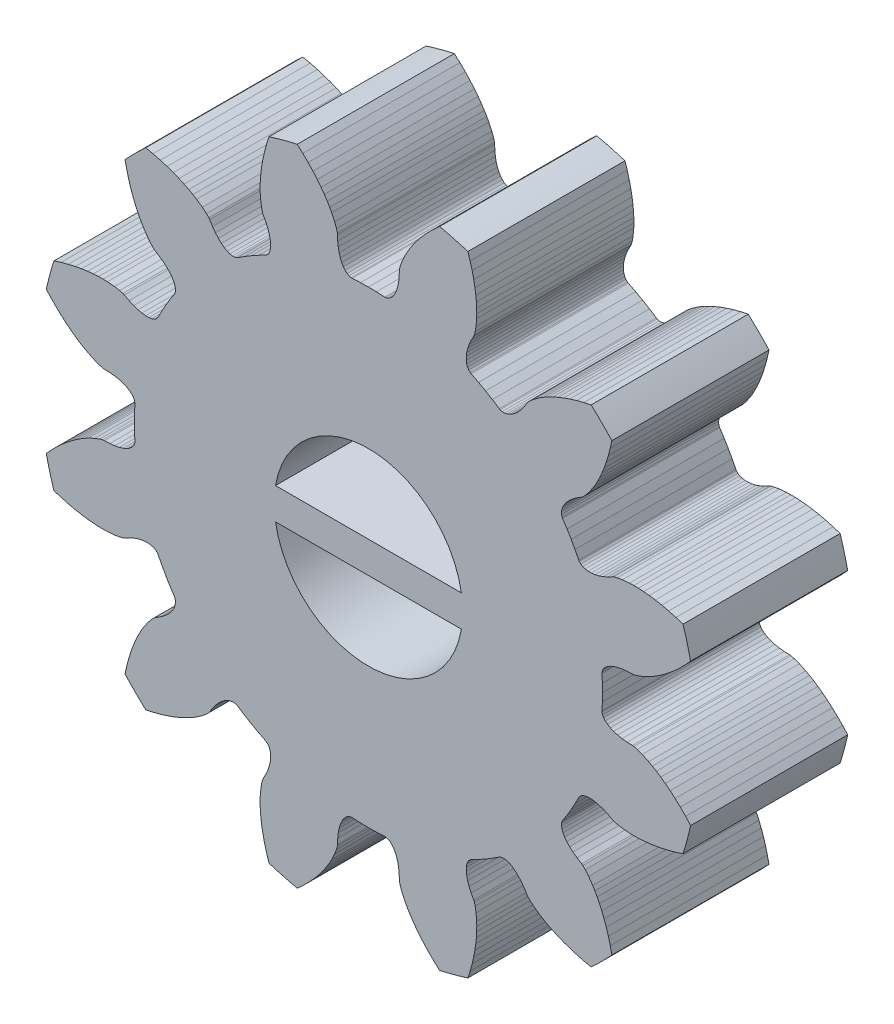
from build123d import *

# Parameters (mm, degrees)
DODANIE_WYCI_GNI_CIE1_DEPTH = 5


with BuildPart() as part:
    # szkic → Dodanie-wyciągnięcie1 (new body)
    with BuildSketch(Plane.XY):
        with BuildLine():
            Line((13.3041035, -6.8561363), (13.3646303, -6.6242917))
            Line((13.3646303, -6.6242917), (13.4304655, -6.4093816))
            Line((13.4304655, -6.4093816), (13.5002922, -6.2114851))
            Line((13.5002922, -6.2114851), (13.5727071, -6.0307313))
            Line((13.5727071, -6.0307313), (13.646359, -5.8670802))
            Line((13.646359, -5.8670802), (13.721124, -5.718017))
            Line((13.721124, -5.718017), (13.7934881, -5.5876952))
            Line((13.7934881, -5.5876952), (13.8641894, -5.4719934))
            Line((13.8641894, -5.4719934), (13.993399, -5.287051))
            Line((13.993399, -5.287051), (14.1005731, -5.157982))
            Line((14.1005731, -5.157982), (14.1765304, -5.080584))
            Line((14.1765304, -5.080584), (14.2152558, -5.0521983))
            Line((14.2152558, -5.0521983), (14.3621288, -4.9615699))
            Line((14.3621288, -4.9615699), (14.4896324, -4.8681526))
            Line((14.4896324, -4.8681526), (14.5978226, -4.7734035))
            Line((14.5978226, -4.7734035), (14.6868312, -4.6787708))
            Line((14.6868312, -4.6787708), (14.7568878, -4.5856924))
            Line((14.7568878, -4.5856924), (14.8083, -4.495561))
            Line((14.8083, -4.495561), (14.8414711, -4.409795))
            Line((14.8414711, -4.409795), (14.8568795, -4.3297232))
            Line((14.8568795, -4.3297232), (14.8550807, -4.2566876))
            Line((14.8550807, -4.2566876), (14.8367255, -4.1919755))
            Line((14.8367255, -4.1919755), (14.821549, -4.163129))
            Line((14.821549, -4.163129), (14.6787997, -3.9427598))
            Line((14.6787997, -3.9427598), (14.5481107, -3.725))
            Line((14.5481107, -3.725), (14.4248697, -3.5029402))
            Line((14.4248697, -3.5029402), (14.305399, -3.269131))
            Line((14.305399, -3.269131), (14.2880055, -3.2415645))
            Line((14.2880055, -3.2415645), (14.2411407, -3.1933124))
            Line((14.2411407, -3.1933124), (14.1787895, -3.1552368))
            Line((14.1787895, -3.1552368), (14.1017411, -3.128545))
            Line((14.1017411, -3.128545), (14.01088, -3.114389))
            Line((14.01088, -3.114389), (13.9071178, -3.1138476))
            Line((13.9071178, -3.1138476), (13.7914812, -3.1279792))
            Line((13.7914812, -3.1279792), (13.6650226, -3.1577465))
            Line((13.6650226, -3.1577465), (13.5288724, -3.2040674))
            Line((13.5288724, -3.2040674), (13.3842188, -3.2677801))
            Line((13.3842188, -3.2677801), (13.2322958, -3.3496617))
            Line((13.2322958, -3.3496617), (13.1883504, -3.369006))
            Line((13.1883504, -3.369006), (13.0833431, -3.396088))
            Line((13.0833431, -3.396088), (12.917979, -3.424369))
            Line((12.917979, -3.424369), (12.6932094, -3.4437966))
            Line((12.6932094, -3.4437966), (12.5576581, -3.4471748))
            Line((12.5576581, -3.4471748), (12.408614, -3.444683))
            Line((12.408614, -3.444683), (12.242139, -3.4348998))
            Line((12.242139, -3.4348998), (12.0635871, -3.4168587))
            Line((12.0635871, -3.4168587), (11.8708422, -3.3891949))
            Line((11.8708422, -3.3891949), (11.6645455, -3.3507184))
            Line((11.6645455, -3.3507184), (11.4455103, -3.3002783))
            Line((11.4455103, -3.3002783), (11.2144635, -3.2367737))
            Line((11.2144635, -3.2367737), (10.9882086, -3.1643386))
            ThreePointArc((10.9882086, -3.1643386), (10.857824593, -2.717587715), (10.747365, -2.2654981))
            Line((10.747365, -2.2654981), (10.90709, -2.08964))
            Line((10.90709, -2.08964), (11.07543, -1.91912))
            Line((11.07543, -1.91912), (11.2399, -1.76592))
            Line((11.2399, -1.76592), (11.39932, -1.62945))
            Line((11.39932, -1.62945), (11.55241, -1.50912))
            Line((11.55241, -1.50912), (11.69802, -1.40422))
            Line((11.69802, -1.40422), (11.8373, -1.31251))
            Line((11.8373, -1.31251), (11.96513, -1.23583))
            Line((11.96513, -1.23583), (12.08421, -1.17098))
            Line((12.08421, -1.17098), (12.28858, -1.07542))
            Line((12.28858, -1.07542), (12.44593, -1.01723))
            Line((12.44593, -1.01723), (12.55041, -0.98818))
            Line((12.55041, -0.98818), (12.59814, -0.98296))
            Line((12.59814, -0.98296), (12.77065, -0.97791))
            Line((12.77065, -0.97791), (12.92778, -0.96076))
            Line((12.92778, -0.96076), (13.06885, -0.9328))
            Line((13.06885, -0.9328), (13.19325, -0.89535))
            Line((13.19325, -0.89535), (13.30046, -0.84977))
            Line((13.30046, -0.84977), (13.39005, -0.79742))
            Line((13.39005, -0.79742), (13.46166, -0.73973))
            Line((13.46166, -0.73973), (13.51504, -0.67809))
            Line((13.51504, -0.67809), (13.55, -0.61394))
            Line((13.55, -0.61394), (13.56646, -0.54872))
            Line((13.56646, -0.54872), (13.56774, -0.51615))
            Line((13.56774, -0.51615), (13.5543, -0.25393))
            Line((13.5543, -0.25393), (13.55, 0))
            Line((13.55, 0), (13.5543, 0.25393))
            Line((13.5543, 0.25393), (13.56774, 0.51615))
            Line((13.56774, 0.51615), (13.56646, 0.54872))
            Line((13.56646, 0.54872), (13.55, 0.61394))
            Line((13.55, 0.61394), (13.51504, 0.67809))
            Line((13.51504, 0.67809), (13.46166, 0.73973))
            Line((13.46166, 0.73973), (13.39005, 0.79742))
            Line((13.39005, 0.79742), (13.30046, 0.84977))
            Line((13.30046, 0.84977), (13.19325, 0.89535))
            Line((13.19325, 0.89535), (13.06885, 0.9328))
            Line((13.06885, 0.9328), (12.92778, 0.96076))
            Line((12.92778, 0.96076), (12.77065, 0.97791))
            Line((12.77065, 0.97791), (12.59814, 0.98296))
            Line((12.59814, 0.98296), (12.55041, 0.98818))
            Line((12.55041, 0.98818), (12.44593, 1.01723))
            Line((12.44593, 1.01723), (12.28858, 1.07542))
            Line((12.28858, 1.07542), (12.08421, 1.17098))
            Line((12.08421, 1.17098), (11.96513, 1.23583))
            Line((11.96513, 1.23583), (11.8373, 1.31251))
            Line((11.8373, 1.31251), (11.69802, 1.40422))
            Line((11.69802, 1.40422), (11.55241, 1.50912))
            Line((11.55241, 1.50912), (11.39932, 1.62945))
            Line((11.39932, 1.62945), (11.2399, 1.76592))
            Line((11.2399, 1.76592), (11.07543, 1.91912))
            Line((11.07543, 1.91912), (10.90709, 2.08964))
            Line((10.90709, 2.08964), (10.747365, 2.2654981))
            ThreePointArc((10.747365, 2.2654981), (10.857824593, 2.717587715), (10.9882086, 3.1643386))
            Line((10.9882086, 3.1643386), (11.2144635, 3.2367737))
            Line((11.2144635, 3.2367737), (11.4455103, 3.3002783))
            Line((11.4455103, 3.3002783), (11.6645455, 3.3507184))
            Line((11.6645455, 3.3507184), (11.8708422, 3.3891949))
            Line((11.8708422, 3.3891949), (12.0635871, 3.4168587))
            Line((12.0635871, 3.4168587), (12.242139, 3.4348998))
            Line((12.242139, 3.4348998), (12.408614, 3.444683))
            Line((12.408614, 3.444683), (12.5576581, 3.4471748))
            Line((12.5576581, 3.4471748), (12.6932094, 3.4437966))
            Line((12.6932094, 3.4437966), (12.917979, 3.424369))
            Line((12.917979, 3.424369), (13.0833431, 3.396088))
            Line((13.0833431, 3.396088), (13.1883504, 3.369006))
            Line((13.1883504, 3.369006), (13.2322958, 3.3496617))
            Line((13.2322958, 3.3496617), (13.3842188, 3.2677801))
            Line((13.3842188, 3.2677801), (13.5288724, 3.2040674))
            Line((13.5288724, 3.2040674), (13.6650226, 3.1577465))
            Line((13.6650226, 3.1577465), (13.7914812, 3.1279792))
            Line((13.7914812, 3.1279792), (13.9071178, 3.1138476))
            Line((13.9071178, 3.1138476), (14.01088, 3.114389))
            Line((14.01088, 3.114389), (14.1017411, 3.128545))
            Line((14.1017411, 3.128545), (14.1787895, 3.1552368))
            Line((14.1787895, 3.1552368), (14.2411407, 3.1933124))
            Line((14.2411407, 3.1933124), (14.2880055, 3.2415645))
            Line((14.2880055, 3.2415645), (14.305399, 3.269131))
            Line((14.305399, 3.269131), (14.4248697, 3.5029402))
            Line((14.4248697, 3.5029402), (14.5481107, 3.725))
            Line((14.5481107, 3.725), (14.6787997, 3.9427598))
            Line((14.6787997, 3.9427598), (14.821549, 4.163129))
            Line((14.821549, 4.163129), (14.8367255, 4.1919755))
            Line((14.8367255, 4.1919755), (14.8550807, 4.2566876))
            Line((14.8550807, 4.2566876), (14.8568795, 4.3297232))
            Line((14.8568795, 4.3297232), (14.8414711, 4.409795))
            Line((14.8414711, 4.409795), (14.8083, 4.495561))
            Line((14.8083, 4.495561), (14.7568878, 4.5856924))
            Line((14.7568878, 4.5856924), (14.6868312, 4.6787708))
            Line((14.6868312, 4.6787708), (14.5978226, 4.7734035))
            Line((14.5978226, 4.7734035), (14.4896324, 4.8681526))
            Line((14.4896324, 4.8681526), (14.3621288, 4.9615699))
            Line((14.3621288, 4.9615699), (14.2152558, 5.0521983))
            Line((14.2152558, 5.0521983), (14.1765304, 5.080584))
            Line((14.1765304, 5.080584), (14.1005731, 5.157982))
            Line((14.1005731, 5.157982), (13.993399, 5.287051))
            Line((13.993399, 5.287051), (13.8641894, 5.4719934))
            Line((13.8641894, 5.4719934), (13.7934881, 5.5876952))
            Line((13.7934881, 5.5876952), (13.721124, 5.718017))
            Line((13.721124, 5.718017), (13.646359, 5.8670802))
            Line((13.646359, 5.8670802), (13.5727071, 6.0307313))
            Line((13.5727071, 6.0307313), (13.5002922, 6.2114851))
            Line((13.5002922, 6.2114851), (13.4304655, 6.4093816))
            Line((13.4304655, 6.4093816), (13.3646303, 6.6242917))
            Line((13.3646303, 6.6242917), (13.3041035, 6.8561363))
            Line((13.3041035, 6.8561363), (13.2537067, 7.0882964))
            ThreePointArc((13.2537067, 7.0882964), (13.575412309, 7.424587691), (13.9117036, 7.7462933))
            Line((13.9117036, 7.7462933), (14.1438637, 7.6958965))
            Line((14.1438637, 7.6958965), (14.3757083, 7.6353697))
            Line((14.3757083, 7.6353697), (14.5906184, 7.5695345))
            Line((14.5906184, 7.5695345), (14.7885149, 7.4997078))
            Line((14.7885149, 7.4997078), (14.9692687, 7.4272929))
            Line((14.9692687, 7.4272929), (15.1329198, 7.353641))
            Line((15.1329198, 7.353641), (15.281983, 7.278876))
            Line((15.281983, 7.278876), (15.4123048, 7.2065119))
            Line((15.4123048, 7.2065119), (15.5280066, 7.1358106))
            Line((15.5280066, 7.1358106), (15.712949, 7.006601))
            Line((15.712949, 7.006601), (15.842018, 6.8994269))
            Line((15.842018, 6.8994269), (15.919416, 6.8234696))
            Line((15.919416, 6.8234696), (15.9478017, 6.7847442))
            Line((15.9478017, 6.7847442), (16.0384301, 6.6378712))
            Line((16.0384301, 6.6378712), (16.1318474, 6.5103676))
            Line((16.1318474, 6.5103676), (16.2265965, 6.4021774))
            Line((16.2265965, 6.4021774), (16.3212292, 6.3131688))
            Line((16.3212292, 6.3131688), (16.4143076, 6.2431122))
            Line((16.4143076, 6.2431122), (16.504439, 6.1917))
            Line((16.504439, 6.1917), (16.590205, 6.1585289))
            Line((16.590205, 6.1585289), (16.6702768, 6.1431205))
            Line((16.6702768, 6.1431205), (16.7433124, 6.1449193))
            Line((16.7433124, 6.1449193), (16.8080245, 6.1632745))
            Line((16.8080245, 6.1632745), (16.836871, 6.178451))
            Line((16.836871, 6.178451), (17.0572402, 6.3212003))
            Line((17.0572402, 6.3212003), (17.275, 6.4518893))
            Line((17.275, 6.4518893), (17.4970598, 6.5751303))
            Line((17.4970598, 6.5751303), (17.730869, 6.694601))
            Line((17.730869, 6.694601), (17.7584355, 6.7119945))
            Line((17.7584355, 6.7119945), (17.8066876, 6.7588593))
            Line((17.8066876, 6.7588593), (17.8447632, 6.8212105))
            Line((17.8447632, 6.8212105), (17.871455, 6.8982589))
            Line((17.871455, 6.8982589), (17.885611, 6.98912))
            Line((17.885611, 6.98912), (17.8861524, 7.0928822))
            Line((17.8861524, 7.0928822), (17.8720208, 7.2085188))
            Line((17.8720208, 7.2085188), (17.8422535, 7.3349774))
            Line((17.8422535, 7.3349774), (17.7959326, 7.4711276))
            Line((17.7959326, 7.4711276), (17.7322199, 7.6157812))
            Line((17.7322199, 7.6157812), (17.6503383, 7.7677042))
            Line((17.6503383, 7.7677042), (17.630994, 7.8116496))
            Line((17.630994, 7.8116496), (17.603912, 7.9166569))
            Line((17.603912, 7.9166569), (17.575631, 8.082021))
            Line((17.575631, 8.082021), (17.5562034, 8.3067906))
            Line((17.5562034, 8.3067906), (17.5528252, 8.4423419))
            Line((17.5528252, 8.4423419), (17.555317, 8.591386))
            Line((17.555317, 8.591386), (17.5651002, 8.757861))
            Line((17.5651002, 8.757861), (17.5831413, 8.9364129))
            Line((17.5831413, 8.9364129), (17.6108051, 9.1291578))
            Line((17.6108051, 9.1291578), (17.6492816, 9.3354545))
            Line((17.6492816, 9.3354545), (17.6997217, 9.5544897))
            Line((17.6997217, 9.5544897), (17.7632263, 9.7855365))
            Line((17.7632263, 9.7855365), (17.8356614, 10.0117914))
            ThreePointArc((17.8356614, 10.0117914), (18.282412285, 10.142175407), (18.7345019, 10.252635))
            Line((18.7345019, 10.252635), (18.91036, 10.09291))
            Line((18.91036, 10.09291), (19.08088, 9.92457))
            Line((19.08088, 9.92457), (19.23408, 9.7601))
            Line((19.23408, 9.7601), (19.37055, 9.60068))
            Line((19.37055, 9.60068), (19.49088, 9.44759))
            Line((19.49088, 9.44759), (19.59578, 9.30198))
            Line((19.59578, 9.30198), (19.68749, 9.1627))
            Line((19.68749, 9.1627), (19.76417, 9.03487))
            Line((19.76417, 9.03487), (19.82902, 8.91579))
            Line((19.82902, 8.91579), (19.92458, 8.71142))
            Line((19.92458, 8.71142), (19.98277, 8.55407))
            Line((19.98277, 8.55407), (20.01182, 8.44959))
            Line((20.01182, 8.44959), (20.01704, 8.40186))
            Line((20.01704, 8.40186), (20.02209, 8.22935))
            Line((20.02209, 8.22935), (20.03924, 8.07222))
            Line((20.03924, 8.07222), (20.0672, 7.93115))
            Line((20.0672, 7.93115), (20.10465, 7.80675))
            Line((20.10465, 7.80675), (20.15023, 7.69954))
            Line((20.15023, 7.69954), (20.20258, 7.60995))
            Line((20.20258, 7.60995), (20.26027, 7.53834))
            Line((20.26027, 7.53834), (20.32191, 7.48496))
            Line((20.32191, 7.48496), (20.38606, 7.45))
            Line((20.38606, 7.45), (20.45128, 7.43354))
            Line((20.45128, 7.43354), (20.48385, 7.43226))
            Line((20.48385, 7.43226), (20.74607, 7.4457))
            Line((20.74607, 7.4457), (21, 7.45))
            Line((21, 7.45), (21.25393, 7.4457))
            Line((21.25393, 7.4457), (21.51615, 7.43226))
            Line((21.51615, 7.43226), (21.54872, 7.43354))
            Line((21.54872, 7.43354), (21.61394, 7.45))
            Line((21.61394, 7.45), (21.67809, 7.48496))
            Line((21.67809, 7.48496), (21.73973, 7.53834))
            Line((21.73973, 7.53834), (21.79742, 7.60995))
            Line((21.79742, 7.60995), (21.84977, 7.69954))
            Line((21.84977, 7.69954), (21.89535, 7.80675))
            Line((21.89535, 7.80675), (21.9328, 7.93115))
            Line((21.9328, 7.93115), (21.96076, 8.07222))
            Line((21.96076, 8.07222), (21.97791, 8.22935))
            Line((21.97791, 8.22935), (21.98296, 8.40186))
            Line((21.98296, 8.40186), (21.98818, 8.44959))
            Line((21.98818, 8.44959), (22.01723, 8.55407))
            Line((22.01723, 8.55407), (22.07542, 8.71142))
            Line((22.07542, 8.71142), (22.17098, 8.91579))
            Line((22.17098, 8.91579), (22.23583, 9.03487))
            Line((22.23583, 9.03487), (22.31251, 9.1627))
            Line((22.31251, 9.1627), (22.40422, 9.30198))
            Line((22.40422, 9.30198), (22.50912, 9.44759))
            Line((22.50912, 9.44759), (22.62945, 9.60068))
            Line((22.62945, 9.60068), (22.76592, 9.7601))
            Line((22.76592, 9.7601), (22.91912, 9.92457))
            Line((22.91912, 9.92457), (23.08964, 10.09291))
            Line((23.08964, 10.09291), (23.2654981, 10.252635))
            ThreePointArc((23.2654981, 10.252635), (23.717587715, 10.142175407), (24.1643386, 10.0117914))
            Line((24.1643386, 10.0117914), (24.2367737, 9.7855365))
            Line((24.2367737, 9.7855365), (24.3002783, 9.5544897))
            Line((24.3002783, 9.5544897), (24.3507184, 9.3354545))
            Line((24.3507184, 9.3354545), (24.3891949, 9.1291578))
            Line((24.3891949, 9.1291578), (24.4168587, 8.9364129))
            Line((24.4168587, 8.9364129), (24.4348998, 8.757861))
            Line((24.4348998, 8.757861), (24.444683, 8.591386))
            Line((24.444683, 8.591386), (24.4471748, 8.4423419))
            Line((24.4471748, 8.4423419), (24.4437966, 8.3067906))
            Line((24.4437966, 8.3067906), (24.424369, 8.082021))
            Line((24.424369, 8.082021), (24.396088, 7.9166569))
            Line((24.396088, 7.9166569), (24.369006, 7.8116496))
            Line((24.369006, 7.8116496), (24.3496617, 7.7677042))
            Line((24.3496617, 7.7677042), (24.2677801, 7.6157812))
            Line((24.2677801, 7.6157812), (24.2040674, 7.4711276))
            Line((24.2040674, 7.4711276), (24.1577465, 7.3349774))
            Line((24.1577465, 7.3349774), (24.1279792, 7.2085188))
            Line((24.1279792, 7.2085188), (24.1138476, 7.0928822))
            Line((24.1138476, 7.0928822), (24.114389, 6.98912))
            Line((24.114389, 6.98912), (24.128545, 6.8982589))
            Line((24.128545, 6.8982589), (24.1552368, 6.8212105))
            Line((24.1552368, 6.8212105), (24.1933124, 6.7588593))
            Line((24.1933124, 6.7588593), (24.2415645, 6.7119945))
            Line((24.2415645, 6.7119945), (24.269131, 6.694601))
            Line((24.269131, 6.694601), (24.5029402, 6.5751303))
            Line((24.5029402, 6.5751303), (24.725, 6.4518893))
            Line((24.725, 6.4518893), (24.9427598, 6.3212003))
            Line((24.9427598, 6.3212003), (25.163129, 6.178451))
            Line((25.163129, 6.178451), (25.1919755, 6.1632745))
            Line((25.1919755, 6.1632745), (25.2566876, 6.1449193))
            Line((25.2566876, 6.1449193), (25.3297232, 6.1431205))
            Line((25.3297232, 6.1431205), (25.409795, 6.1585289))
            Line((25.409795, 6.1585289), (25.495561, 6.1917))
            Line((25.495561, 6.1917), (25.5856924, 6.2431122))
            Line((25.5856924, 6.2431122), (25.6787708, 6.3131688))
            Line((25.6787708, 6.3131688), (25.7734035, 6.4021774))
            Line((25.7734035, 6.4021774), (25.8681526, 6.5103676))
            Line((25.8681526, 6.5103676), (25.9615699, 6.6378712))
            Line((25.9615699, 6.6378712), (26.0521983, 6.7847442))
            Line((26.0521983, 6.7847442), (26.080584, 6.8234696))
            Line((26.080584, 6.8234696), (26.157982, 6.8994269))
            Line((26.157982, 6.8994269), (26.287051, 7.006601))
            Line((26.287051, 7.006601), (26.4719934, 7.1358106))
            Line((26.4719934, 7.1358106), (26.5876952, 7.2065119))
            Line((26.5876952, 7.2065119), (26.718017, 7.278876))
            Line((26.718017, 7.278876), (26.8670802, 7.353641))
            Line((26.8670802, 7.353641), (27.0307313, 7.4272929))
            Line((27.0307313, 7.4272929), (27.2114851, 7.4997078))
            Line((27.2114851, 7.4997078), (27.4093816, 7.5695345))
            Line((27.4093816, 7.5695345), (27.6242917, 7.6353697))
            Line((27.6242917, 7.6353697), (27.8561363, 7.6958965))
            Line((27.8561363, 7.6958965), (28.0882964, 7.7462933))
            ThreePointArc((28.0882964, 7.7462933), (28.424587691, 7.424587691), (28.7462933, 7.0882964))
            Line((28.7462933, 7.0882964), (28.6958965, 6.8561363))
            Line((28.6958965, 6.8561363), (28.6353697, 6.6242917))
            Line((28.6353697, 6.6242917), (28.5695345, 6.4093816))
            Line((28.5695345, 6.4093816), (28.4997078, 6.2114851))
            Line((28.4997078, 6.2114851), (28.4272929, 6.0307313))
            Line((28.4272929, 6.0307313), (28.353641, 5.8670802))
            Line((28.353641, 5.8670802), (28.278876, 5.718017))
            Line((28.278876, 5.718017), (28.2065119, 5.5876952))
            Line((28.2065119, 5.5876952), (28.1358106, 5.4719934))
            Line((28.1358106, 5.4719934), (28.006601, 5.287051))
            Line((28.006601, 5.287051), (27.8994269, 5.157982))
            Line((27.8994269, 5.157982), (27.8234696, 5.080584))
            Line((27.8234696, 5.080584), (27.7847442, 5.0521983))
            Line((27.7847442, 5.0521983), (27.6378712, 4.9615699))
            Line((27.6378712, 4.9615699), (27.5103676, 4.8681526))
            Line((27.5103676, 4.8681526), (27.4021774, 4.7734035))
            Line((27.4021774, 4.7734035), (27.3131688, 4.6787708))
            Line((27.3131688, 4.6787708), (27.2431122, 4.5856924))
            Line((27.2431122, 4.5856924), (27.1917, 4.495561))
            Line((27.1917, 4.495561), (27.1585289, 4.409795))
            Line((27.1585289, 4.409795), (27.1431205, 4.3297232))
            Line((27.1431205, 4.3297232), (27.1449193, 4.2566876))
            Line((27.1449193, 4.2566876), (27.1632745, 4.1919755))
            Line((27.1632745, 4.1919755), (27.178451, 4.163129))
            Line((27.178451, 4.163129), (27.3212003, 3.9427598))
            Line((27.3212003, 3.9427598), (27.4518893, 3.725))
            Line((27.4518893, 3.725), (27.5751303, 3.5029402))
            Line((27.5751303, 3.5029402), (27.694601, 3.269131))
            Line((27.694601, 3.269131), (27.7119945, 3.2415645))
            Line((27.7119945, 3.2415645), (27.7588593, 3.1933124))
            Line((27.7588593, 3.1933124), (27.8212105, 3.1552368))
            Line((27.8212105, 3.1552368), (27.8982589, 3.128545))
            Line((27.8982589, 3.128545), (27.98912, 3.114389))
            Line((27.98912, 3.114389), (28.0928822, 3.1138476))
            Line((28.0928822, 3.1138476), (28.2085188, 3.1279792))
            Line((28.2085188, 3.1279792), (28.3349774, 3.1577465))
            Line((28.3349774, 3.1577465), (28.4711276, 3.2040674))
            Line((28.4711276, 3.2040674), (28.6157812, 3.2677801))
            Line((28.6157812, 3.2677801), (28.7677042, 3.3496617))
            Line((28.7677042, 3.3496617), (28.8116496, 3.369006))
            Line((28.8116496, 3.369006), (28.9166569, 3.396088))
            Line((28.9166569, 3.396088), (29.082021, 3.424369))
            Line((29.082021, 3.424369), (29.3067906, 3.4437966))
            Line((29.3067906, 3.4437966), (29.4423419, 3.4471748))
            Line((29.4423419, 3.4471748), (29.591386, 3.444683))
            Line((29.591386, 3.444683), (29.757861, 3.4348998))
            Line((29.757861, 3.4348998), (29.9364129, 3.4168587))
            Line((29.9364129, 3.4168587), (30.1291578, 3.3891949))
            Line((30.1291578, 3.3891949), (30.3354545, 3.3507184))
            Line((30.3354545, 3.3507184), (30.5544897, 3.3002783))
            Line((30.5544897, 3.3002783), (30.7855365, 3.2367737))
            Line((30.7855365, 3.2367737), (31.0117914, 3.1643386))
            ThreePointArc((31.0117914, 3.1643386), (31.142175407, 2.717587715), (31.252635, 2.2654981))
            Line((31.252635, 2.2654981), (31.09291, 2.08964))
            Line((31.09291, 2.08964), (30.92457, 1.91912))
            Line((30.92457, 1.91912), (30.7601, 1.76592))
            Line((30.7601, 1.76592), (30.60068, 1.62945))
            Line((30.60068, 1.62945), (30.44759, 1.50912))
            Line((30.44759, 1.50912), (30.30198, 1.40422))
            Line((30.30198, 1.40422), (30.1627, 1.31251))
            Line((30.1627, 1.31251), (30.03487, 1.23583))
            Line((30.03487, 1.23583), (29.91579, 1.17098))
            Line((29.91579, 1.17098), (29.71142, 1.07542))
            Line((29.71142, 1.07542), (29.55407, 1.01723))
            Line((29.55407, 1.01723), (29.44959, 0.98818))
            Line((29.44959, 0.98818), (29.40186, 0.98296))
            Line((29.40186, 0.98296), (29.22935, 0.97791))
            Line((29.22935, 0.97791), (29.07222, 0.96076))
            Line((29.07222, 0.96076), (28.93115, 0.9328))
            Line((28.93115, 0.9328), (28.80675, 0.89535))
            Line((28.80675, 0.89535), (28.69954, 0.84977))
            Line((28.69954, 0.84977), (28.60995, 0.79742))
            Line((28.60995, 0.79742), (28.53834, 0.73973))
            Line((28.53834, 0.73973), (28.48496, 0.67809))
            Line((28.48496, 0.67809), (28.45, 0.61394))
            Line((28.45, 0.61394), (28.43354, 0.54872))
            Line((28.43354, 0.54872), (28.43226, 0.51615))
            Line((28.43226, 0.51615), (28.4457, 0.25393))
            Line((28.4457, 0.25393), (28.45, 0))
            Line((28.45, 0), (28.4457, -0.25393))
            Line((28.4457, -0.25393), (28.43226, -0.51615))
            Line((28.43226, -0.51615), (28.43354, -0.54872))
            Line((28.43354, -0.54872), (28.45, -0.61394))
            Line((28.45, -0.61394), (28.48496, -0.67809))
            Line((28.48496, -0.67809), (28.53834, -0.73973))
            Line((28.53834, -0.73973), (28.60995, -0.79742))
            Line((28.60995, -0.79742), (28.69954, -0.84977))
            Line((28.69954, -0.84977), (28.80675, -0.89535))
            Line((28.80675, -0.89535), (28.93115, -0.9328))
            Line((28.93115, -0.9328), (29.07222, -0.96076))
            Line((29.07222, -0.96076), (29.22935, -0.97791))
            Line((29.22935, -0.97791), (29.40186, -0.98296))
            Line((29.40186, -0.98296), (29.44959, -0.98818))
            Line((29.44959, -0.98818), (29.55407, -1.01723))
            Line((29.55407, -1.01723), (29.71142, -1.07542))
            Line((29.71142, -1.07542), (29.91579, -1.17098))
            Line((29.91579, -1.17098), (30.03487, -1.23583))
            Line((30.03487, -1.23583), (30.1627, -1.31251))
            Line((30.1627, -1.31251), (30.30198, -1.40422))
            Line((30.30198, -1.40422), (30.44759, -1.50912))
            Line((30.44759, -1.50912), (30.60068, -1.62945))
            Line((30.60068, -1.62945), (30.7601, -1.76592))
            Line((30.7601, -1.76592), (30.92457, -1.91912))
            Line((30.92457, -1.91912), (31.09291, -2.08964))
            Line((31.09291, -2.08964), (31.252635, -2.2654981))
            ThreePointArc((31.252635, -2.2654981), (31.142175407, -2.717587715), (31.0117914, -3.1643386))
            Line((31.0117914, -3.1643386), (30.7855365, -3.2367737))
            Line((30.7855365, -3.2367737), (30.5544897, -3.3002783))
            Line((30.5544897, -3.3002783), (30.3354545, -3.3507184))
            Line((30.3354545, -3.3507184), (30.1291578, -3.3891949))
            Line((30.1291578, -3.3891949), (29.9364129, -3.4168587))
            Line((29.9364129, -3.4168587), (29.757861, -3.4348998))
            Line((29.757861, -3.4348998), (29.591386, -3.444683))
            Line((29.591386, -3.444683), (29.4423419, -3.4471748))
            Line((29.4423419, -3.4471748), (29.3067906, -3.4437966))
            Line((29.3067906, -3.4437966), (29.082021, -3.424369))
            Line((29.082021, -3.424369), (28.9166569, -3.396088))
            Line((28.9166569, -3.396088), (28.8116496, -3.369006))
            Line((28.8116496, -3.369006), (28.7677042, -3.3496617))
            Line((28.7677042, -3.3496617), (28.6157812, -3.2677801))
            Line((28.6157812, -3.2677801), (28.4711276, -3.2040674))
            Line((28.4711276, -3.2040674), (28.3349774, -3.1577465))
            Line((28.3349774, -3.1577465), (28.2085188, -3.1279792))
            Line((28.2085188, -3.1279792), (28.0928822, -3.1138476))
            Line((28.0928822, -3.1138476), (27.98912, -3.114389))
            Line((27.98912, -3.114389), (27.8982589, -3.128545))
            Line((27.8982589, -3.128545), (27.8212105, -3.1552368))
            Line((27.8212105, -3.1552368), (27.7588593, -3.1933124))
            Line((27.7588593, -3.1933124), (27.7119945, -3.2415645))
            Line((27.7119945, -3.2415645), (27.694601, -3.269131))
            Line((27.694601, -3.269131), (27.5751303, -3.5029402))
            Line((27.5751303, -3.5029402), (27.4518893, -3.725))
            Line((27.4518893, -3.725), (27.3212003, -3.9427598))
            Line((27.3212003, -3.9427598), (27.178451, -4.163129))
            Line((27.178451, -4.163129), (27.1632745, -4.1919755))
            Line((27.1632745, -4.1919755), (27.1449193, -4.2566876))
            Line((27.1449193, -4.2566876), (27.1431205, -4.3297232))
            Line((27.1431205, -4.3297232), (27.1585289, -4.409795))
            Line((27.1585289, -4.409795), (27.1917, -4.495561))
            Line((27.1917, -4.495561), (27.2431122, -4.5856924))
            Line((27.2431122, -4.5856924), (27.3131688, -4.6787708))
            Line((27.3131688, -4.6787708), (27.4021774, -4.7734035))
            Line((27.4021774, -4.7734035), (27.5103676, -4.8681526))
            Line((27.5103676, -4.8681526), (27.6378712, -4.9615699))
            Line((27.6378712, -4.9615699), (27.7847442, -5.0521983))
            Line((27.7847442, -5.0521983), (27.8234696, -5.080584))
            Line((27.8234696, -5.080584), (27.8994269, -5.157982))
            Line((27.8994269, -5.157982), (28.006601, -5.287051))
            Line((28.006601, -5.287051), (28.1358106, -5.4719934))
            Line((28.1358106, -5.4719934), (28.2065119, -5.5876952))
            Line((28.2065119, -5.5876952), (28.278876, -5.718017))
            Line((28.278876, -5.718017), (28.353641, -5.8670802))
            Line((28.353641, -5.8670802), (28.4272929, -6.0307313))
            Line((28.4272929, -6.0307313), (28.4997078, -6.2114851))
            Line((28.4997078, -6.2114851), (28.5695345, -6.4093816))
            Line((28.5695345, -6.4093816), (28.6353697, -6.6242917))
            Line((28.6353697, -6.6242917), (28.6958965, -6.8561363))
            Line((28.6958965, -6.8561363), (28.7462933, -7.0882964))
            ThreePointArc((28.7462933, -7.0882964), (28.424587691, -7.424587691), (28.0882964, -7.7462933))
            Line((28.0882964, -7.7462933), (27.8561363, -7.6958965))
            Line((27.8561363, -7.6958965), (27.6242917, -7.6353697))
            Line((27.6242917, -7.6353697), (27.4093816, -7.5695345))
            Line((27.4093816, -7.5695345), (27.2114851, -7.4997078))
            Line((27.2114851, -7.4997078), (27.0307313, -7.4272929))
            Line((27.0307313, -7.4272929), (26.8670802, -7.353641))
            Line((26.8670802, -7.353641), (26.718017, -7.278876))
            Line((26.718017, -7.278876), (26.5876952, -7.2065119))
            Line((26.5876952, -7.2065119), (26.4719934, -7.1358106))
            Line((26.4719934, -7.1358106), (26.287051, -7.006601))
            Line((26.287051, -7.006601), (26.157982, -6.8994269))
            Line((26.157982, -6.8994269), (26.080584, -6.8234696))
            Line((26.080584, -6.8234696), (26.0521983, -6.7847442))
            Line((26.0521983, -6.7847442), (25.9615699, -6.6378712))
            Line((25.9615699, -6.6378712), (25.8681526, -6.5103676))
            Line((25.8681526, -6.5103676), (25.7734035, -6.4021774))
            Line((25.7734035, -6.4021774), (25.6787708, -6.3131688))
            Line((25.6787708, -6.3131688), (25.5856924, -6.2431122))
            Line((25.5856924, -6.2431122), (25.495561, -6.1917))
            Line((25.495561, -6.1917), (25.409795, -6.1585289))
            Line((25.409795, -6.1585289), (25.3297232, -6.1431205))
            Line((25.3297232, -6.1431205), (25.2566876, -6.1449193))
            Line((25.2566876, -6.1449193), (25.1919755, -6.1632745))
            Line((25.1919755, -6.1632745), (25.163129, -6.178451))
            Line((25.163129, -6.178451), (24.9427598, -6.3212003))
            Line((24.9427598, -6.3212003), (24.725, -6.4518893))
            Line((24.725, -6.4518893), (24.5029402, -6.5751303))
            Line((24.5029402, -6.5751303), (24.269131, -6.694601))
            Line((24.269131, -6.694601), (24.2415645, -6.7119945))
            Line((24.2415645, -6.7119945), (24.1933124, -6.7588593))
            Line((24.1933124, -6.7588593), (24.1552368, -6.8212105))
            Line((24.1552368, -6.8212105), (24.128545, -6.8982589))
            Line((24.128545, -6.8982589), (24.114389, -6.98912))
            Line((24.114389, -6.98912), (24.1138476, -7.0928822))
            Line((24.1138476, -7.0928822), (24.1279792, -7.2085188))
            Line((24.1279792, -7.2085188), (24.1577465, -7.3349774))
            Line((24.1577465, -7.3349774), (24.2040674, -7.4711276))
            Line((24.2040674, -7.4711276), (24.2677801, -7.6157812))
            Line((24.2677801, -7.6157812), (24.3496617, -7.7677042))
            Line((24.3496617, -7.7677042), (24.369006, -7.8116496))
            Line((24.369006, -7.8116496), (24.396088, -7.9166569))
            Line((24.396088, -7.9166569), (24.424369, -8.082021))
            Line((24.424369, -8.082021), (24.4437966, -8.3067906))
            Line((24.4437966, -8.3067906), (24.4471748, -8.4423419))
            Line((24.4471748, -8.4423419), (24.444683, -8.591386))
            Line((24.444683, -8.591386), (24.4348998, -8.757861))
            Line((24.4348998, -8.757861), (24.4168587, -8.9364129))
            Line((24.4168587, -8.9364129), (24.3891949, -9.1291578))
            Line((24.3891949, -9.1291578), (24.3507184, -9.3354545))
            Line((24.3507184, -9.3354545), (24.3002783, -9.5544897))
            Line((24.3002783, -9.5544897), (24.2367737, -9.7855365))
            Line((24.2367737, -9.7855365), (24.1643386, -10.0117914))
            ThreePointArc((24.1643386, -10.0117914), (23.717587715, -10.142175407), (23.2654981, -10.252635))
            Line((23.2654981, -10.252635), (23.08964, -10.09291))
            Line((23.08964, -10.09291), (22.91912, -9.92457))
            Line((22.91912, -9.92457), (22.76592, -9.7601))
            Line((22.76592, -9.7601), (22.62945, -9.60068))
            Line((22.62945, -9.60068), (22.50912, -9.44759))
            Line((22.50912, -9.44759), (22.40422, -9.30198))
            Line((22.40422, -9.30198), (22.31251, -9.1627))
            Line((22.31251, -9.1627), (22.23583, -9.03487))
            Line((22.23583, -9.03487), (22.17098, -8.91579))
            Line((22.17098, -8.91579), (22.07542, -8.71142))
            Line((22.07542, -8.71142), (22.01723, -8.55407))
            Line((22.01723, -8.55407), (21.98818, -8.44959))
            Line((21.98818, -8.44959), (21.98296, -8.40186))
            Line((21.98296, -8.40186), (21.97791, -8.22935))
            Line((21.97791, -8.22935), (21.96076, -8.07222))
            Line((21.96076, -8.07222), (21.9328, -7.93115))
            Line((21.9328, -7.93115), (21.89535, -7.80675))
            Line((21.89535, -7.80675), (21.84977, -7.69954))
            Line((21.84977, -7.69954), (21.79742, -7.60995))
            Line((21.79742, -7.60995), (21.73973, -7.53834))
            Line((21.73973, -7.53834), (21.67809, -7.48496))
            Line((21.67809, -7.48496), (21.61394, -7.45))
            Line((21.61394, -7.45), (21.54872, -7.43354))
            Line((21.54872, -7.43354), (21.51615, -7.43226))
            Line((21.51615, -7.43226), (21.25393, -7.4457))
            Line((21.25393, -7.4457), (21, -7.45))
            Line((21, -7.45), (20.74607, -7.4457))
            Line((20.74607, -7.4457), (20.48385, -7.43226))
            Line((20.48385, -7.43226), (20.45128, -7.43354))
            Line((20.45128, -7.43354), (20.38606, -7.45))
            Line((20.38606, -7.45), (20.32191, -7.48496))
            Line((20.32191, -7.48496), (20.26027, -7.53834))
            Line((20.26027, -7.53834), (20.20258, -7.60995))
            Line((20.20258, -7.60995), (20.15023, -7.69954))
            Line((20.15023, -7.69954), (20.10465, -7.80675))
            Line((20.10465, -7.80675), (20.0672, -7.93115))
            Line((20.0672, -7.93115), (20.03924, -8.07222))
            Line((20.03924, -8.07222), (20.02209, -8.22935))
            Line((20.02209, -8.22935), (20.01704, -8.40186))
            Line((20.01704, -8.40186), (20.01182, -8.44959))
            Line((20.01182, -8.44959), (19.98277, -8.55407))
            Line((19.98277, -8.55407), (19.92458, -8.71142))
            Line((19.92458, -8.71142), (19.82902, -8.91579))
            Line((19.82902, -8.91579), (19.76417, -9.03487))
            Line((19.76417, -9.03487), (19.68749, -9.1627))
            Line((19.68749, -9.1627), (19.59578, -9.30198))
            Line((19.59578, -9.30198), (19.49088, -9.44759))
            Line((19.49088, -9.44759), (19.37055, -9.60068))
            Line((19.37055, -9.60068), (19.23408, -9.7601))
            Line((19.23408, -9.7601), (19.08088, -9.92457))
            Line((19.08088, -9.92457), (18.91036, -10.09291))
            Line((18.91036, -10.09291), (18.7345019, -10.252635))
            ThreePointArc((18.7345019, -10.252635), (18.282412285, -10.142175407), (17.8356614, -10.0117914))
            Line((17.8356614, -10.0117914), (17.7632263, -9.7855365))
            Line((17.7632263, -9.7855365), (17.6997217, -9.5544897))
            Line((17.6997217, -9.5544897), (17.6492816, -9.3354545))
            Line((17.6492816, -9.3354545), (17.6108051, -9.1291578))
            Line((17.6108051, -9.1291578), (17.5831413, -8.9364129))
            Line((17.5831413, -8.9364129), (17.5651002, -8.757861))
            Line((17.5651002, -8.757861), (17.555317, -8.591386))
            Line((17.555317, -8.591386), (17.5528252, -8.4423419))
            Line((17.5528252, -8.4423419), (17.5562034, -8.3067906))
            Line((17.5562034, -8.3067906), (17.575631, -8.082021))
            Line((17.575631, -8.082021), (17.603912, -7.9166569))
            Line((17.603912, -7.9166569), (17.630994, -7.8116496))
            Line((17.630994, -7.8116496), (17.6503383, -7.7677042))
            Line((17.6503383, -7.7677042), (17.7322199, -7.6157812))
            Line((17.7322199, -7.6157812), (17.7959326, -7.4711276))
            Line((17.7959326, -7.4711276), (17.8422535, -7.3349774))
            Line((17.8422535, -7.3349774), (17.8720208, -7.2085188))
            Line((17.8720208, -7.2085188), (17.8861524, -7.0928822))
            Line((17.8861524, -7.0928822), (17.885611, -6.98912))
            Line((17.885611, -6.98912), (17.871455, -6.8982589))
            Line((17.871455, -6.8982589), (17.8447632, -6.8212105))
            Line((17.8447632, -6.8212105), (17.8066876, -6.7588593))
            Line((17.8066876, -6.7588593), (17.7584355, -6.7119945))
            Line((17.7584355, -6.7119945), (17.730869, -6.694601))
            Line((17.730869, -6.694601), (17.4970598, -6.5751303))
            Line((17.4970598, -6.5751303), (17.275, -6.4518893))
            Line((17.275, -6.4518893), (17.0572402, -6.3212003))
            Line((17.0572402, -6.3212003), (16.836871, -6.178451))
            Line((16.836871, -6.178451), (16.8080245, -6.1632745))
            Line((16.8080245, -6.1632745), (16.7433124, -6.1449193))
            Line((16.7433124, -6.1449193), (16.6702768, -6.1431205))
            Line((16.6702768, -6.1431205), (16.590205, -6.1585289))
            Line((16.590205, -6.1585289), (16.504439, -6.1917))
            Line((16.504439, -6.1917), (16.4143076, -6.2431122))
            Line((16.4143076, -6.2431122), (16.3212292, -6.3131688))
            Line((16.3212292, -6.3131688), (16.2265965, -6.4021774))
            Line((16.2265965, -6.4021774), (16.1318474, -6.5103676))
            Line((16.1318474, -6.5103676), (16.0384301, -6.6378712))
            Line((16.0384301, -6.6378712), (15.9478017, -6.7847442))
            Line((15.9478017, -6.7847442), (15.919416, -6.8234696))
            Line((15.919416, -6.8234696), (15.842018, -6.8994269))
            Line((15.842018, -6.8994269), (15.712949, -7.006601))
            Line((15.712949, -7.006601), (15.5280066, -7.1358106))
            Line((15.5280066, -7.1358106), (15.4123048, -7.2065119))
            Line((15.4123048, -7.2065119), (15.281983, -7.278876))
            Line((15.281983, -7.278876), (15.1329198, -7.353641))
            Line((15.1329198, -7.353641), (14.9692687, -7.4272929))
            Line((14.9692687, -7.4272929), (14.7885149, -7.4997078))
            Line((14.7885149, -7.4997078), (14.5906184, -7.5695345))
            Line((14.5906184, -7.5695345), (14.3757083, -7.6353697))
            Line((14.3757083, -7.6353697), (14.1438637, -7.6958965))
            Line((14.1438637, -7.6958965), (13.9117036, -7.7462933))
            ThreePointArc((13.9117036, -7.7462933), (13.575412309, -7.424587691), (13.2537067, -7.0882964))
            Line((13.2537067, -7.0882964), (13.3041035, -6.8561363))
        make_face()
        with BuildLine():
            Line((18.041960108, 0.5), (23.958039892, 0.5))
            ThreePointArc((23.958039892, 0.5), (21, 3), (18.041960108, 0.5))
        make_face(mode=Mode.SUBTRACT)
        with BuildLine():
            Line((18.041960108, -0.5), (23.958039892, -0.5))
            ThreePointArc((23.958039892, -0.5), (21, -3), (18.041960108, -0.5))
        make_face(mode=Mode.SUBTRACT)
    extrude(amount=DODANIE_WYCI_GNI_CIE1_DEPTH)


solid = part.part
